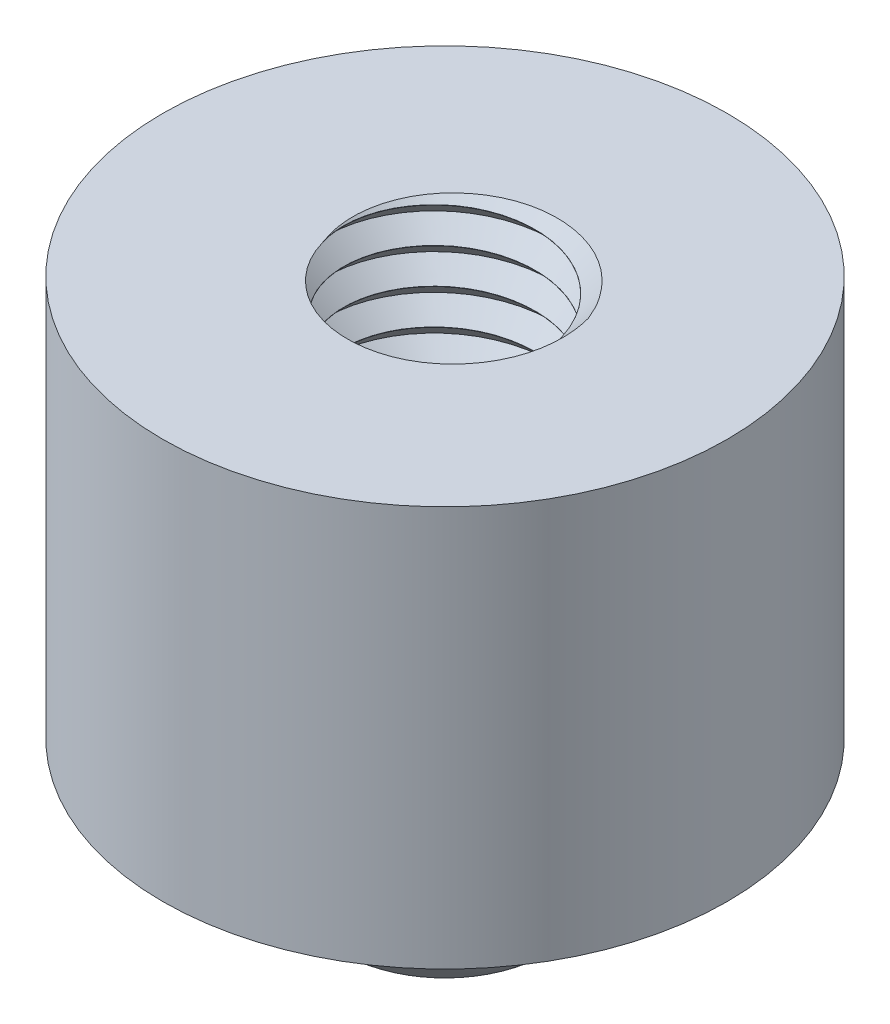
from build123d import *

# Parameters (mm, degrees)
SKETCH_1_W    = 6.6
SKETCH_1_H    = 11
SWEEP_1_PITCH = 1.25


with BuildPart() as part:
    # 草图1 → 旋转1 (revolve)
    with BuildSketch(Plane.XY, mode=Mode.PRIVATE) as revolve_1_sk:
        with Locations((6.7, -5.5)):
            Rectangle(SKETCH_1_W, SKETCH_1_H)
    revolve(revolve_1_sk.sketch.rotate(Axis((0, 16.878026906, 0), (0, -1, 0)), 90), axis=Axis((0, 16.878026906, 0), (0, -1, 0)))

    # 切除-扫描1: arcs per turn and ends read off the stored shape
    # 切除-扫描1: the profile of 草图3 profile screwed along a right-hand helix through 11.25 turns, 8 arcs to a turn; built about Z, then put on its axis
    sweep_1_z = Axis((0, 0, 0), (0, 0, 1))
    sweep_1_corners = [(3.3997, 0, -1.8702976), (3.3997, 0, -0.6297024), (4.025, 0, -1.25)]
    with BuildLine(mode=Mode.PRIVATE) as sweep_1_profile:
        Line(sweep_1_corners[0], sweep_1_corners[1])
        Line(sweep_1_corners[1], sweep_1_corners[2])
        Line(sweep_1_corners[2], sweep_1_corners[0])
    sweep_1_cap = Face(sweep_1_profile.wire())
    sweep_1_turn_angles = [0, 22.5, 45, 67.5, 90, 112.5, 135, 157.5, 180, 202.5, 225, 247.5, 270, 292.5, 315, 337.5, 360]
    sweep_1_turn_weights = [1, 0.9238795325112867, 1, 0.9238795325112867, 1, 0.9238795325112867, 1, 0.9238795325112867, 1, 0.9238795325112867, 1, 0.9238795325112867, 1, 0.9238795325112867, 1, 0.9238795325112867, 1]
    sweep_1_turn_rails = [Edge.make_bspline([Vector(p[0], p[1], 0).rotate(sweep_1_z, sweep_1_turn_angles[k]) / sweep_1_turn_weights[k] + Vector(0, 0, p[2] + SWEEP_1_PITCH * sweep_1_turn_angles[k] / 360) for k in range(17)], [0, 0, 0, 1, 1, 2, 2, 3, 3, 4, 4, 5, 5, 6, 6, 7, 7, 8, 8, 8], 2, sweep_1_turn_weights) for p in sweep_1_corners]
    sweep_1_turn_sides = [Face.make_surface_from_curves(sweep_1_turn_rails[p[0]], sweep_1_turn_rails[p[1]]) for p in [(0, 1), (1, 2), (2, 0)]]
    sweep_1_last_angles = [3960, 3982.5, 4005, 4027.5, 4050]
    sweep_1_last_weights = [1, 0.9238795325112867, 1, 0.9238795325112867, 1]
    sweep_1_last_rails = [Edge.make_bspline([Vector(p[0], p[1], 0).rotate(sweep_1_z, sweep_1_last_angles[k]) / sweep_1_last_weights[k] + Vector(0, 0, p[2] + SWEEP_1_PITCH * sweep_1_last_angles[k] / 360) for k in range(5)], [0, 0, 0, 1, 1, 2, 2, 2], 2, sweep_1_last_weights) for p in sweep_1_corners]
    sweep_1_last_sides = [Face.make_surface_from_curves(sweep_1_last_rails[p[0]], sweep_1_last_rails[p[1]]) for p in [(0, 1), (1, 2), (2, 0)]]
    sweep_1 = Plane(origin=(0, -11, 0), x_dir=(0, 0, -1), z_dir=(0, 1, 0)) * Solid(Shell([*[p.moved(Location((0, 0, SWEEP_1_PITCH * i))) for i in range(11) for p in sweep_1_turn_sides], *sweep_1_last_sides, sweep_1_cap, sweep_1_cap.rotate(sweep_1_z, 4050).moved(Location((0, 0, SWEEP_1_PITCH * 4050 / 360)))]))
    add(sweep_1, mode=Mode.SUBTRACT)

    # 草图4 → 旋转2 (revolve)
    with BuildSketch(Plane.XY, mode=Mode.PRIVATE) as revolve_2_sk:
        Polygon((0, -13.323834833), (4.025, -11), (10, -11), (10, -14.182082338), (0, -14.182082338), align=None)
    revolve(revolve_2_sk.sketch.rotate(Axis((0, 0, 0), (0, -1, 0)), 90), axis=Axis((0, 0, 0), (0, -1, 0)))

    # 草图9 → 旋转3 (revolve)
    with BuildSketch(Plane(origin=(0, 0, 0), x_dir=(0, 0, -1), z_dir=(1, 0, 0)), mode=Mode.PRIVATE) as revolve_3_sk:
        with BuildLine():
            Line((6, -14.182082338), (0, -14.182082338))
            Line((0, -14.182082338), (0, -20.182082338))
            ThreePointArc((0, -20.182082338), (4.242640687, -18.424723026), (6, -14.182082338))
        make_face()
    revolve(revolve_3_sk.sketch.rotate(Axis((0, -14.182082338, 0), (0, -1, 0)), 270), axis=Axis((0, -14.182082338, 0), (0, -1, 0)))


solid = part.part
